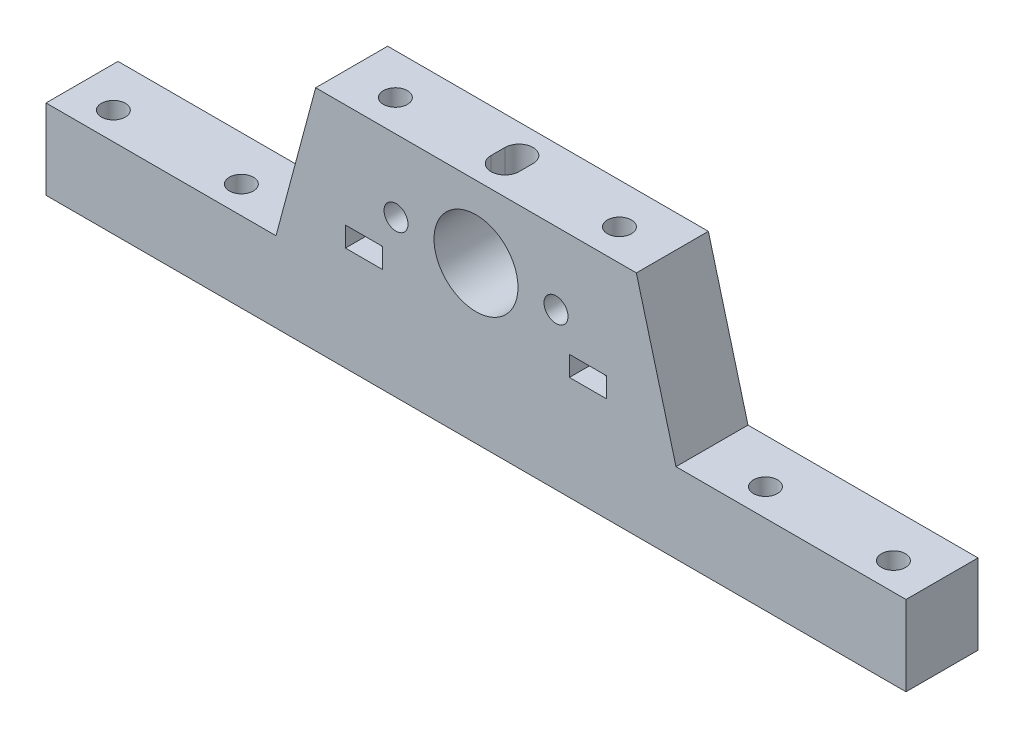
from build123d import *

# Parameters (mm, degrees)
SKETCH1_W           = 215
SKETCH1_H           = 18
SKETCH1_R           = 3
BOSS_EXTRUDE1_DEPTH = 20
SKETCH1_3_W         = 80
SKETCH1_3_H         = 18
SKETCH1_3_R         = 3
BOSS_EXTRUDE2_DEPTH = 47
BOSS_EXTRUDE3_START = 47
SKETCH1_6_W         = 25
SKETCH1_6_H         = 18
SKETCH1_6_W_2       = 27.5
SKETCH1_6_R         = 3
BOSS_EXTRUDE3_DEPTH = 10
SKETCH2_R           = 6.975
SKETCH2_R_2         = 4.475
SKETCH2_R_3         = 3
BOSS_EXTRUDE4_DEPTH = 25
SKETCH2_6_R         = 10.5
SKETCH2_6_R_2       = 3
SKETCH2_6_W         = 9.3
SKETCH2_6_H         = 5
CUT_EXTRUDE5_DEPTH  = 224.828059035
SKETCH1_8_R         = 3
CUT_EXTRUDE6_DEPTH  = 57
CHAMFER1_SIZE       = 37.320508076
CHAMFER1_SIZE_2     = 10
CHAMFER2_SIZE       = 10
CHAMFER2_SIZE_2     = 37.320508076


with BuildPart() as part:
    # Sketch1 → Boss-Extrude1 (new body)
    with BuildSketch(Plane(origin=(0, 0, 0), x_dir=(1, 0, 0), z_dir=(0, 1, 0))):
        with Locations((107.5, -9)):
            Rectangle(SKETCH1_W, SKETCH1_H)
        with Locations(Location((9.99, -11.15, 0), (0, 0, 270))):
            Circle(SKETCH1_R, mode=Mode.SUBTRACT)
        with Locations(Location((41.99, -11.15, 0), (0, 0, 270))):
            Circle(SKETCH1_R, mode=Mode.SUBTRACT)
        with Locations(Location((79.5033, -10.15, 0), (0, 0, 270))):
            Circle(SKETCH1_R, mode=Mode.SUBTRACT)
        with Locations(Location((135.5033, -10.15, 0), (0, 0, 270))):
            Circle(SKETCH1_R, mode=Mode.SUBTRACT)
        with Locations(Location((173.0133, -11.15, 0), (0, 0, 270))):
            Circle(SKETCH1_R, mode=Mode.SUBTRACT)
        with Locations(Location((205.0133, -11.15, 0), (0, 0, 270))):
            Circle(SKETCH1_R, mode=Mode.SUBTRACT)
    extrude(amount=BOSS_EXTRUDE1_DEPTH)

    # Sketch1<3> → Boss-Extrude2 (add)
    with BuildSketch(Plane(origin=(0, 0, 0), x_dir=(1, 0, 0), z_dir=(0, 1, 0))):
        with Locations((107.5033, -9)):
            Rectangle(SKETCH1_3_W, SKETCH1_3_H)
        with Locations((79.5033, -10.15)):
            Circle(SKETCH1_3_R, mode=Mode.SUBTRACT)
        with Locations((135.5033, -10.15)):
            Circle(SKETCH1_3_R, mode=Mode.SUBTRACT)
    extrude(amount=BOSS_EXTRUDE2_DEPTH)

    # Sketch1<6> → Boss-Extrude3 (add)
    # profile 1 of 3: a face of its own
    with BuildSketch(Plane(origin=(0, 0, 0), x_dir=(1, 0, 0), z_dir=(0, 1, 0)).offset(BOSS_EXTRUDE3_START)):
        with Locations((107.5033, -9)):
            Rectangle(SKETCH1_6_W, SKETCH1_6_H)
        with BuildLine():
            ThreePointArc((111.0033, -10.75), (107.5033, -14.25), (104.0033, -10.75))
            Line((104.0033, -10.75), (104.0033, -7.25))
            ThreePointArc((104.0033, -7.25), (107.5033, -3.75), (111.0033, -7.25))
            Line((111.0033, -7.25), (111.0033, -10.75))
        make_face(mode=Mode.SUBTRACT)
    # profile 2 of 3: a face of its own
    with BuildSketch(Plane(origin=(0, 0, 0), x_dir=(1, 0, 0), z_dir=(0, 1, 0)).offset(BOSS_EXTRUDE3_START)):
        with Locations((81.2533, -9)):
            Rectangle(SKETCH1_6_W_2, SKETCH1_6_H)
        with Locations(Location((79.5033, -10.15, 0), (0, 0, 270))):
            Circle(SKETCH1_6_R, mode=Mode.SUBTRACT)
    # profile 3 of 3: a face of its own
    with BuildSketch(Plane(origin=(0, 0, 0), x_dir=(1, 0, 0), z_dir=(0, 1, 0)).offset(BOSS_EXTRUDE3_START)):
        with Locations((133.7533, -9)):
            Rectangle(SKETCH1_6_W_2, SKETCH1_6_H)
        with Locations(Location((135.5033, -10.15, 0), (0, 0, 270))):
            Circle(SKETCH1_6_R, mode=Mode.SUBTRACT)
    extrude(amount=BOSS_EXTRUDE3_DEPTH)

    # Sketch2 → Boss-Extrude4 (add)
    # profile 1 of 4: a face of its own
    with BuildSketch(Plane.XY.offset(18)):
        with Locations((87.5033, 38.99)):
            Circle(SKETCH2_R)
        with Locations((87.5033, 38.99)):
            Circle(SKETCH2_R_2, mode=Mode.SUBTRACT)
    # profile 2 of 4: a face of its own
    with BuildSketch(Plane.XY.offset(18)):
        with Locations((87.5033, 38.99)):
            Circle(SKETCH2_R_2)
        with Locations((87.5033, 38.99)):
            Circle(SKETCH2_R_3, mode=Mode.SUBTRACT)
    # profile 3 of 4: a face of its own
    with BuildSketch(Plane.XY.offset(18)):
        with Locations((127.5033, 38.99)):
            Circle(SKETCH2_R)
        with Locations((127.5033, 38.99)):
            Circle(SKETCH2_R_2, mode=Mode.SUBTRACT)
    # profile 4 of 4: a face of its own
    with BuildSketch(Plane.XY.offset(18)):
        with Locations((127.5033, 38.99)):
            Circle(SKETCH2_R_2)
        with Locations((127.5033, 38.99)):
            Circle(SKETCH2_R_3, mode=Mode.SUBTRACT)
    extrude(amount=-BOSS_EXTRUDE4_DEPTH)

    # Sketch2<6> → Cut-Extrude5 (cut, through all)
    with BuildSketch(Plane.XY.offset(18)):
        with Locations((107.5033, 39.05)):
            Circle(SKETCH2_6_R)
        with Locations((87.5033, 38.99)):
            Circle(SKETCH2_6_R_2)
        with Locations((79.5033, 28.5)):
            Rectangle(SKETCH2_6_W, SKETCH2_6_H)
        with Locations((127.5033, 38.99)):
            Circle(SKETCH2_6_R_2)
        with Locations((135.5033, 28.5)):
            Rectangle(SKETCH2_6_W, SKETCH2_6_H)
    extrude(amount=-CUT_EXTRUDE5_DEPTH, mode=Mode.SUBTRACT)

    # Sketch1<8> → Cut-Extrude6 (cut)
    with BuildSketch(Plane(origin=(0, 0, 0), x_dir=(1, 0, 0), z_dir=(0, 1, 0))):
        with Locations(Location((135.5033, -10.15, 0), (0, 0, 180))):
            Circle(SKETCH1_8_R)
        with Locations(Location((79.5033, -10.15, 0), (0, 0, 270))):
            Circle(SKETCH1_8_R)
    extrude(amount=CUT_EXTRUDE6_DEPTH, mode=Mode.SUBTRACT)

    # Chamfer1
    # the kernel refuses this chamfer: 37.320508076, 10 mm, written as the material it adds along each edge
    with BuildSketch(Plane(origin=(147.5033, 20, 18), x_dir=(-0.009967146577156421, 0.9999503267608394, 0), z_dir=(0, 0, -1))) as chamfer1_piece_1_section:
        Polygon((CHAMFER1_SIZE * 0.999950326753, CHAMFER1_SIZE * 0.00996714657707), (-CHAMFER1_SIZE_2 * 0.00996714657716, CHAMFER1_SIZE_2 * 0.999950326761), (0, 0), align=None)
    chamfer1_piece_1 = extrude(amount=18, mode=Mode.PRIVATE)
    chamfer1_piece_1 = split(chamfer1_piece_1, bisect_by=Plane(origin=(150.477287082, 57, 9), z_dir=(0, -1, 0)), keep=Keep.TOP, mode=Mode.PRIVATE)
    add(chamfer1_piece_1)

    # Chamfer2
    # the kernel refuses this chamfer: 37.320508076, 10 mm, written as the material it adds along each edge
    with BuildSketch(Plane(origin=(67.5033, 20, 0), x_dir=(-0.9905000388259542, -0.137512447021291, 0), z_dir=(0, 0, 1))) as chamfer2_piece_1_section:
        Polygon((CHAMFER2_SIZE * 0.990500038826, -CHAMFER2_SIZE * 0.137512447021), (-CHAMFER2_SIZE_2 * 0.13751244702, -CHAMFER2_SIZE_2 * 0.990500038818), (0, 0), align=None)
    chamfer2_piece_1 = extrude(amount=18, mode=Mode.PRIVATE)
    chamfer2_piece_1 = split(chamfer2_piece_1, bisect_by=Plane(origin=(64.529312918, 57, 9), z_dir=(0, -1, 0)), keep=Keep.TOP, mode=Mode.PRIVATE)
    add(chamfer2_piece_1)


solid = part.part
